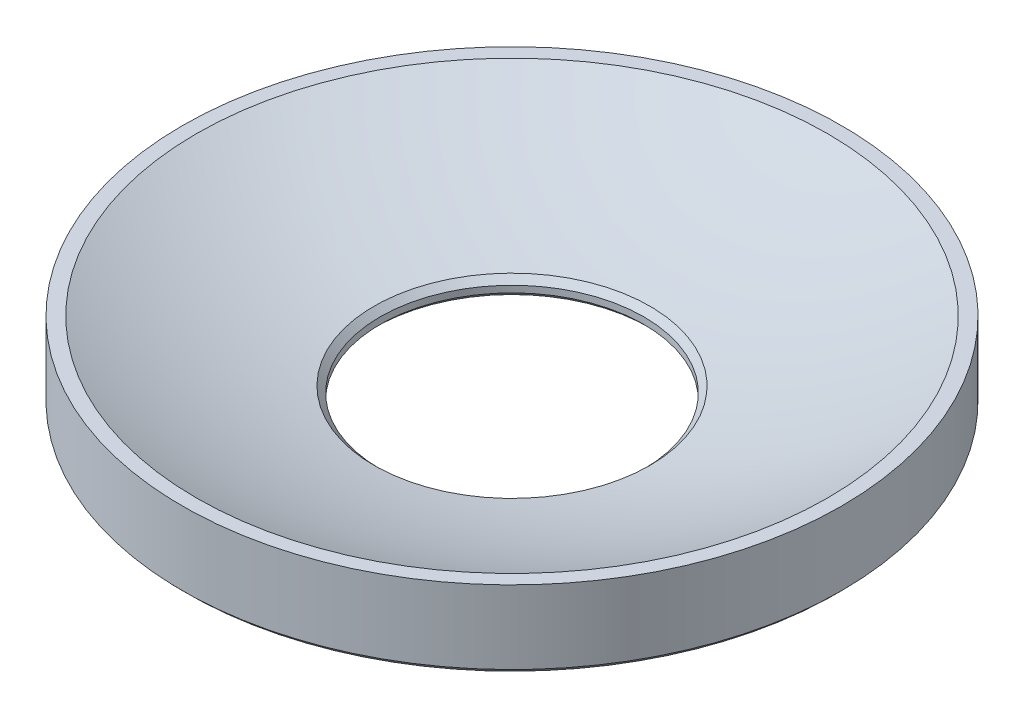
from build123d import *

# Parameters (mm, degrees)
SFAZOWANIE1_SIZE = 0.3


with BuildPart() as part:
    # Szkic1 → Obrót1 (revolve)
    with BuildSketch(Plane.XY):
        with BuildLine():
            Line((8, 0), (20, 0))
            Line((20, 0), (20, 4.749260349))
            Line((20, 4.749260349), (19.150718002, 4.749260349))
            ThreePointArc((19.150718002, 4.749260349), (13.704182219, 2.491495571), (8, 1))
            Line((8, 1), (8, 0))
        make_face()
    revolve(axis=Axis((0, 0.249260349, 0), (0, 1, 0)))

    # Sfazowanie1
    # the kernel refuses this chamfer: 0.37665047, 0.3 mm, written as the material it takes off along each edge
    with BuildSketch(Plane(origin=(0, 0, 0), x_dir=(1, 0, 0), z_dir=(0, 0, 1))) as sfazowanie1_piece_1:
        Polygon((20 - SFAZOWANIE1_SIZE, 0), (20, SFAZOWANIE1_SIZE), (20, 0), align=None)
    revolve(axis=Axis((0, 0, 0), (0, 1, 0)), mode=Mode.SUBTRACT)
    with BuildSketch(Plane(origin=(0, 0, 0), x_dir=(1, 0, 0), z_dir=(0, 0, 1))) as sfazowanie1_piece_2:
        Polygon((8, SFAZOWANIE1_SIZE), (8 + SFAZOWANIE1_SIZE, 0), (8, 0), align=None)
    revolve(axis=Axis((0, 0, 0), (0, 1, 0)), mode=Mode.SUBTRACT)
    with BuildSketch(Plane(origin=(0, 1, 0), x_dir=(1, 0, 0), z_dir=(0, 0, 1))) as sfazowanie1_piece_3:
        with BuildLine():
            Line((8.372172674, 0.072172674), (8, -SFAZOWANIE1_SIZE))
            Line((8, -SFAZOWANIE1_SIZE), (8, 0))
            ThreePointArc((8, 0), (8.192295557, 0.036865326), (8.372172674, 0.072172674))
        make_face()
    revolve(axis=Axis((0, 1, 0), (0, 1, 0)), mode=Mode.SUBTRACT)


solid = part.part
